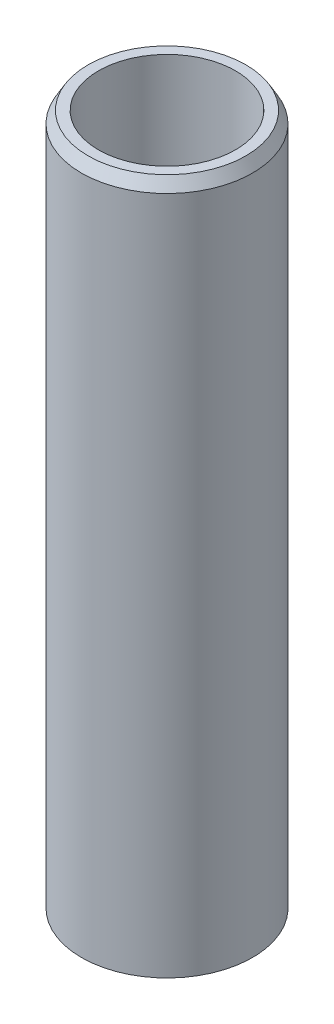
from build123d import *
from OCP.BRepFilletAPI import BRepFilletAPI_MakeChamfer

# Parameters (mm, degrees)
SKETCH1_R           = 27.5
BOSS_EXTRUDE1_DEPTH = 224.14876666
SKETCH2_R           = 22.019834641
CUT_EXTRUDE1_DEPTH  = 228.497625471
CHAMFER1_SIZE       = 3.715787062
CHAMFER1_SIZE2      = 2.14531066


with BuildPart() as part:
    # Sketch1 → Boss-Extrude1 (new body)
    with BuildSketch(Plane(origin=(0, 0, 0), x_dir=(1, 0, 0), z_dir=(0, 1, 0))):
        Circle(SKETCH1_R)
    extrude(amount=BOSS_EXTRUDE1_DEPTH)

    # Sketch2 → Cut-Extrude1 (cut, through all)
    with BuildSketch(Plane(origin=(0, 0, 0), x_dir=(1, 0, 0), z_dir=(0, 1, 0))):
        Circle(SKETCH2_R)
    extrude(amount=CUT_EXTRUDE1_DEPTH, mode=Mode.SUBTRACT)

    # Chamfer1: one chamfer whose edges measure the first distance from different faces: ONE call of the kernel's chamfer builder (chamfer() names one face for all edges)
    chamfer1_edges_1 = [part.edges().sort_by_distance(p)[0] for p in [
        (-27.5, 224.14876666, 0),
    ]]
    chamfer1_side_1 = [part.faces().sort_by_distance(p)[0] for p in [
        (-27.5, 112.07438333, 0),
    ]]
    chamfer1_edges_2 = [part.edges().sort_by_distance(p)[0] for p in [
        (-27.5, 0, 0),
    ]]
    chamfer1_side_2 = [part.faces().sort_by_distance(p)[0] for p in [
        (-26.722182541, 0, 0),
    ]]
    chamfer1 = BRepFilletAPI_MakeChamfer(part.part.solid().wrapped)
    for e in chamfer1_edges_1:
        chamfer1.Add(CHAMFER1_SIZE, CHAMFER1_SIZE2, e.wrapped, chamfer1_side_1[0].wrapped)  # the first distance lies on this face
    for e in chamfer1_edges_2:
        chamfer1.Add(CHAMFER1_SIZE, CHAMFER1_SIZE2, e.wrapped, chamfer1_side_2[0].wrapped)  # the first distance lies on this face
    add(Compound.cast(chamfer1.Shape()), mode=Mode.REPLACE)


solid = part.part
